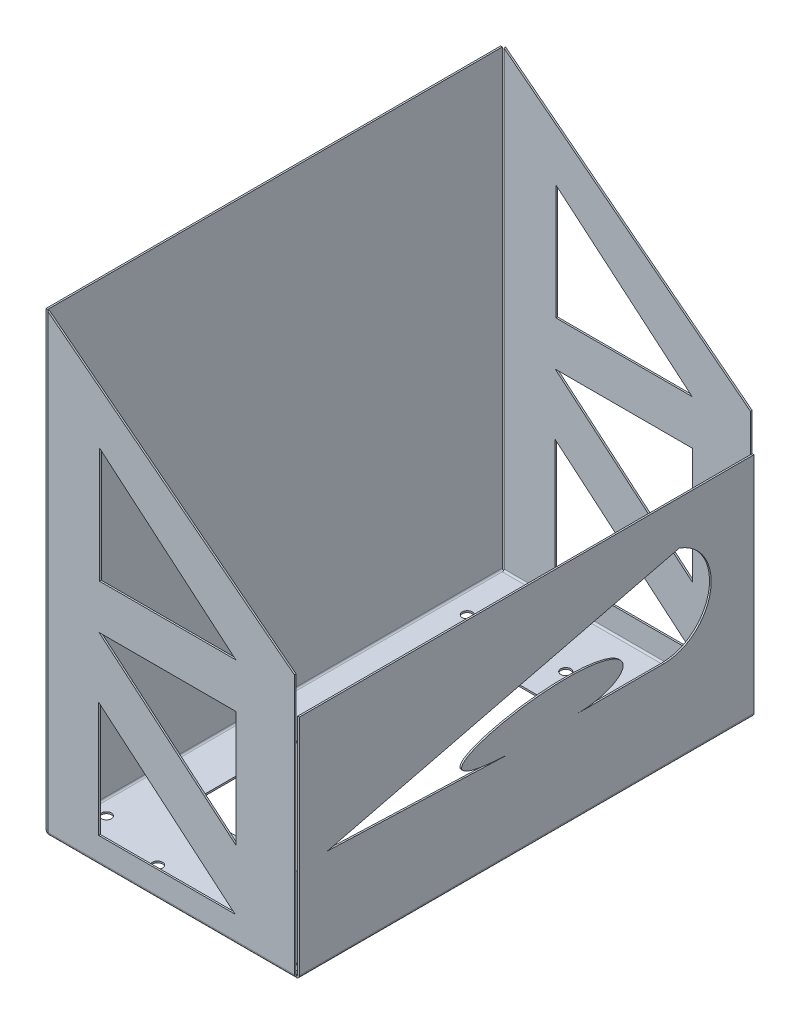
from build123d import *

# Parameters (mm, degrees)
SKETCH1_W                    = 110
SKETCH1_H                    = 200
SKETCH1_W_2                  = 70
SKETCH1_H_2                  = 120
BASE_FLANGE1_DEPTH           = 0.7366
EDGE_FLANGE1_STRIP_W         = 4.4196
EDGE_FLANGE1_STRIP_H         = 0.7366
EDGE_FLANGE1_STRIP_CUT_DEPTH = 200
EDGE_FLANGE1_DEPTH           = 200
EDGE_FLANGE2_STRIP_W         = 4.4196
EDGE_FLANGE2_STRIP_H         = 0.7366
EDGE_FLANGE2_STRIP_CUT_DEPTH = 200
EDGE_FLANGE2_DEPTH           = 200
EDGE_FLANGE3_STRIP_W         = 4.4196
EDGE_FLANGE3_STRIP_H         = 0.7366
EDGE_FLANGE3_STRIP_CUT_DEPTH = 108.5268
EDGE_FLANGE3_DEPTH           = 108.5268
EDGE_FLANGE3_START           = 0.7366
EDGE_FLANGE3_FLAT_DEPTH      = 0.7366
EDGE_FLANGE4_STRIP_W         = 4.4196
EDGE_FLANGE4_STRIP_H         = 0.7366
EDGE_FLANGE4_STRIP_CUT_DEPTH = 108.5268
EDGE_FLANGE4_DEPTH           = 108.5268
EDGE_FLANGE4_START           = 0.7366
EDGE_FLANGE4_FLAT_DEPTH      = 0.7366
CUT_EXTRUDE2_DEPTH           = 289.797370967
CUT_EXTRUDE3_START           = -0.7366
CUT_EXTRUDE3_DEPTH           = 0.7366
CUT_EXTRUDE6_DEPTH           = 800.082459726
CUT_EXTRUDE6_DEPTH_BACK      = 800.082459726
SKETCH53_R                   = 2.2
SKETCH53_R_2                 = 2.199999998


# Read off the part's stored shape, not the designer's step: Cut-Extrude3
# Sheet-metal steps are written as plain solids
with BuildPart() as part:
    # Sketch1 → Base-Flange1 (new body)
    with BuildSketch(Plane(origin=(0, 0, 0), x_dir=(1, 0, 0), z_dir=(0, 1, 0))):
        Rectangle(SKETCH1_W, SKETCH1_H)
        Rectangle(SKETCH1_W_2, SKETCH1_H_2, mode=Mode.SUBTRACT)
    extrude(amount=-BASE_FLANGE1_DEPTH)

    # Edge-Flange1 strip (across the edge) → Edge-Flange1 strip cut (cut)
    with BuildSketch(Plane(origin=(-55, 0, -100), x_dir=(1, 0, 0), z_dir=(0, 0, 1))):
        with Locations((-1.4732, -0.3683)):
            Rectangle(EDGE_FLANGE1_STRIP_W, EDGE_FLANGE1_STRIP_H)
    extrude(amount=EDGE_FLANGE1_STRIP_CUT_DEPTH, mode=Mode.SUBTRACT)

    # Edge-Flange1 section (across the edge) → Edge-Flange1 (add)
    with BuildSketch(Plane(origin=(-55, 0, -100), x_dir=(1, 0, 0), z_dir=(0, 0, 1))):
        with BuildLine():
            Line((-0.7366, 0.7366), (-0.7366, 199.2634))
            Line((-0.7366, 199.2634), (0, 199.2634))
            Line((0, 199.2634), (0, 0.7366))
            ThreePointArc((0, 0.7366), (0.215745145, 0.215745145), (0.7366, 0))
            Line((0.7366, 0), (0.7366, -0.7366))
            ThreePointArc((0.7366, -0.7366), (-0.30510971, -0.30510971), (-0.7366, 0.7366))
        make_face()
    extrude(amount=EDGE_FLANGE1_DEPTH)

    # Edge-Flange2 strip (across the edge) → Edge-Flange2 strip cut (cut)
    with BuildSketch(Plane(origin=(55, 0, 100), x_dir=(-1, 0, 0), z_dir=(0, 0, -1))):
        with Locations((-1.4732, -0.3683)):
            Rectangle(EDGE_FLANGE2_STRIP_W, EDGE_FLANGE2_STRIP_H)
    extrude(amount=EDGE_FLANGE2_STRIP_CUT_DEPTH, mode=Mode.SUBTRACT)

    # Edge-Flange2 section (across the edge) → Edge-Flange2 (add)
    with BuildSketch(Plane(origin=(55, 0, 100), x_dir=(-1, 0, 0), z_dir=(0, 0, -1))):
        with BuildLine():
            Line((-0.7366, 0.7366), (-0.7366, 99.2634))
            Line((-0.7366, 99.2634), (0, 99.2634))
            Line((0, 99.2634), (0, 0.7366))
            ThreePointArc((0, 0.7366), (0.215745145, 0.215745145), (0.7366, 0))
            Line((0.7366, 0), (0.7366, -0.7366))
            ThreePointArc((0.7366, -0.7366), (-0.30510971, -0.30510971), (-0.7366, 0.7366))
        make_face()
    extrude(amount=EDGE_FLANGE2_DEPTH)

    # Edge-Flange3 strip (across the edge) → Edge-Flange3 strip cut (cut)
    with BuildSketch(Plane(origin=(54.2634, 0, -100), x_dir=(0, 0, 1), z_dir=(-1, 0, 0))):
        with Locations((-1.4732, -0.3683)):
            Rectangle(EDGE_FLANGE3_STRIP_W, EDGE_FLANGE3_STRIP_H)
    extrude(amount=EDGE_FLANGE3_STRIP_CUT_DEPTH, mode=Mode.SUBTRACT)

    # Edge-Flange3 bend section (across the edge) → Edge-Flange3 (add)
    with BuildSketch(Plane(origin=(54.2634, 0, -100), x_dir=(0, 0, 1), z_dir=(-1, 0, 0))):
        with BuildLine():
            Line((-0.7366, 0.7366), (0, 0.7366))
            ThreePointArc((0, 0.7366), (0.215745145, 0.215745145), (0.7366, 0))
            Line((0.7366, 0), (0.7366, -0.7366))
            ThreePointArc((0.7366, -0.7366), (-0.30510971, -0.30510971), (-0.7366, 0.7366))
        make_face()
    extrude(amount=EDGE_FLANGE3_DEPTH)

    # Edge-Flange3 profile (on flange) → Edge-Flange3 flat (add)
    with BuildSketch(Plane(origin=(0, 0, -100), x_dir=(-1, 0, 0), z_dir=(0, 0, -1)).offset(EDGE_FLANGE3_START)):
        Polygon((-54.2634, 115), (-54.2634, 0.7366), (54.2634, 0.7366), (54.2634, 199.2634), align=None)
    extrude(amount=-EDGE_FLANGE3_FLAT_DEPTH)

    # Edge-Flange4 strip (across the edge) → Edge-Flange4 strip cut (cut)
    with BuildSketch(Plane(origin=(-54.2634, 0, 100), x_dir=(0, 0, -1), z_dir=(1, 0, 0))):
        with Locations((-1.4732, -0.3683)):
            Rectangle(EDGE_FLANGE4_STRIP_W, EDGE_FLANGE4_STRIP_H)
    extrude(amount=EDGE_FLANGE4_STRIP_CUT_DEPTH, mode=Mode.SUBTRACT)

    # Edge-Flange4 bend section (across the edge) → Edge-Flange4 (add)
    with BuildSketch(Plane(origin=(-54.2634, 0, 100), x_dir=(0, 0, -1), z_dir=(1, 0, 0))):
        with BuildLine():
            Line((-0.7366, 0.7366), (0, 0.7366))
            ThreePointArc((0, 0.7366), (0.215745145, 0.215745145), (0.7366, 0))
            Line((0.7366, 0), (0.7366, -0.7366))
            ThreePointArc((0.7366, -0.7366), (-0.30510971, -0.30510971), (-0.7366, 0.7366))
        make_face()
    extrude(amount=EDGE_FLANGE4_DEPTH)

    # Edge-Flange4 profile (on flange) → Edge-Flange4 flat (add)
    with BuildSketch(Plane.XY.offset(100).offset(EDGE_FLANGE4_START)):
        Polygon((-54.2634, 199.2634), (-54.2634, 0.7366), (54.2634, 0.7366), (54.2634, 115), align=None)
    extrude(amount=-EDGE_FLANGE4_FLAT_DEPTH)

    # Sketch24 → Cut-Extrude2 (cut, through all)
    with BuildSketch(Plane(origin=(0, 0, -100.7366), x_dir=(-1, 0, 0), z_dir=(0, 0, -1))):
        Polygon((-28.519875042, 107.808063094), (31.460124178, 107.808063094), (31.460124178, 158.533542729), align=None)
        Polygon((-28.150641863, 10.732953924), (31.829357358, 10.732953924), (31.829357358, 61.45843356), align=None)
        Polygon((31.713150602, 88.173102361), (-28.636081798, 88.173102361), (-28.636081798, 37.135359798), align=None)
    extrude(amount=-CUT_EXTRUDE2_DEPTH, mode=Mode.SUBTRACT)

    # Cut-Extrude3 outline → Cut-Extrude3 (cut)
    with BuildSketch(Plane(origin=(55.7366, 0, 0), x_dir=(0, 0, -1), z_dir=(1, 0, 0)).offset(CUT_EXTRUDE3_START)):
        with BuildLine():
            Line((-87.713422796, 42.053472661), (-6.797155753, 39.040000774))
            add(Edge.make_bspline(
                [(-6.797155753, 39.040000774), (-87.713422796, 42.053472661), (67.110125935, 80.068334048), (60.312641059, 39.424036929), (22.052524279, 39.424036929)],
                knots=[0, 0, 0, 0, 0, 1, 1, 1, 1, 1], degree=4))
            Line((22.052524279, 39.424036929), (60.312641059, 39.424036929))
            ThreePointArc((60.312641059, 39.424036929), (80.917037974, 56.86865569), (67.110125935, 80.068334048))
            Line((67.110125935, 80.068334048), (-87.713422796, 42.053472661))
        make_face()
    extrude(amount=CUT_EXTRUDE3_DEPTH, mode=Mode.SUBTRACT)

    # Sketch53 → Cut-Extrude6 (cut, two sides: drawn at the far end of the back side and taken through both)
    with BuildSketch(Plane(origin=(344.115063699, 0, 561.793038506), x_dir=(-1, 0, 0), z_dir=(0, 1, 0)).offset(-CUT_EXTRUDE6_DEPTH_BACK)):
        with Locations(Location((392.463649434, -480.956438506, 0), (0, 0, 90))):
            Circle(SKETCH53_R)
        with Locations(Location((392.463649434, -465.956438506, 0), (0, 0, 90))):
            Circle(SKETCH53_R)
        with Locations(Location((362.463649434, -473.456438506, 0), (0, 0, 90))):
            Circle(SKETCH53_R)
        with Locations(Location((292.463649434, -480.956438506, 0), (0, 0, 90))):
            Circle(SKETCH53_R)
        with Locations(Location((292.463649434, -465.956438506, 0), (0, 0, 90))):
            Circle(SKETCH53_R)
        with Locations(Location((322.463649434, -473.456438506, 0), (0, 0, 90))):
            Circle(SKETCH53_R)
        with Locations(Location((294.03158687, -636.983238506, 0), (0, 0, 90))):
            Circle(SKETCH53_R_2)
        with Locations(Location((324.69158687, -646.983238506, 0), (0, 0, 90))):
            Circle(SKETCH53_R_2)
        with Locations(Location((346.36158687, -636.983238506, 0), (0, 0, 90))):
            Circle(SKETCH53_R_2)
        with Locations(Location((368.028253537, -646.983238506, 0), (0, 0, 90))):
            Circle(SKETCH53_R_2)
        with Locations(Location((389.694920203, -636.983238506, 0), (0, 0, 90))):
            Circle(SKETCH53_R_2)
    extrude(amount=CUT_EXTRUDE6_DEPTH + CUT_EXTRUDE6_DEPTH_BACK, mode=Mode.SUBTRACT)


solid = part.part
